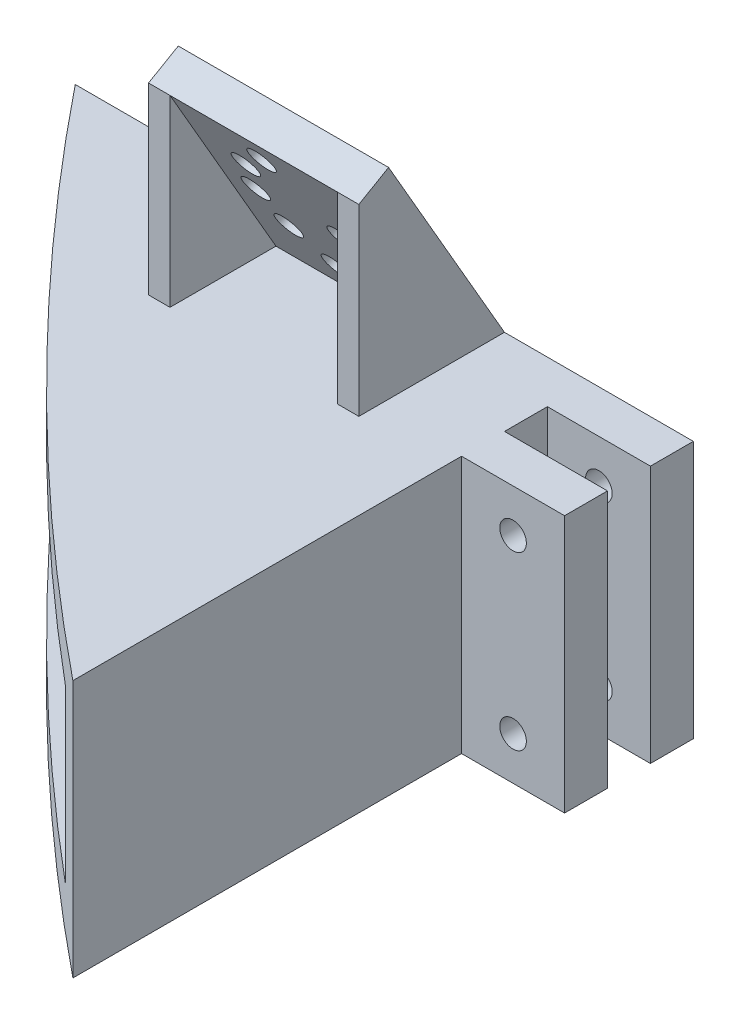
from build123d import *

# Parameters (mm, degrees)
EXTRUDE_1_DEPTH          = 30
CUT_EXTRUDE_1_DEPTH      = 98.124713642
CUT_EXTRUDE_1_DEPTH_BACK = 98.124713642
SKETCH_2_R               = 1.55
CUT_EXTRUDE_6_DEPTH      = 10
EXTRUDE_3_DEPTH          = 12.5
SKETCH_12_W              = 5
SKETCH_12_H              = 30
EXTRUDE_4_DEPTH          = 2
SKETCH_14_W              = 22
SKETCH_14_H              = 27
SKETCH_14_R              = 1.55
EXTRUDE_5_DEPTH          = 4
EXTRUDE_8_DEPTH          = 2.5
EXTRUDE_9_DEPTH          = 2.5


with BuildPart() as part:
    # 草图1 → 凸台-拉伸1 (new body)
    with BuildSketch(Plane(origin=(0, 0, 0), x_dir=(1, 0, 0), z_dir=(0, 1, 0))):
        with BuildLine():
            Line((0, 0), (-70, 0))
            ThreePointArc((-70, 0), (-41.606545869, -31.737243891), (-10, -60.276114672))
            Line((-10, -60.276114672), (-10, -15))
            Line((-10, -15), (0, -15))
            Line((0, -15), (0, -10))
            Line((0, -10), (-10, -10))
            Line((-10, -10), (-10, -5))
            Line((-10, -5), (0, -5))
            Line((0, -5), (0, 0))
        make_face()
    extrude(amount=EXTRUDE_1_DEPTH)

    # 草图2 → 切除-拉伸1 (cut, two sides: drawn at the far end of the back side and taken through both)
    with BuildSketch(Plane(origin=(0, 0, 0), x_dir=(-1, 0, 0), z_dir=(0, 0, -1)).offset(-CUT_EXTRUDE_1_DEPTH_BACK)):
        with Locations((4, 25)):
            Circle(SKETCH_2_R)
        with Locations((4, 5)):
            Circle(SKETCH_2_R)
    extrude(amount=CUT_EXTRUDE_1_DEPTH + CUT_EXTRUDE_1_DEPTH_BACK, mode=Mode.SUBTRACT)

    # 草图9 → 切除-拉伸6 (cut, symmetric)
    with BuildSketch(Plane(origin=(0, 15, 0), x_dir=(1, 0, 0), z_dir=(0, 1, 0))):
        with BuildLine():
            Line((-65.918016471, -5), (-59.391772218, -5))
            Line((-59.391772218, -5), (-15, -5))
            Line((-15, -5), (-15, -15))
            Line((-15, -15), (-15, -49.60330608))
            Line((-15, -49.60330608), (-15, -56.155472209))
            ThreePointArc((-15, -56.155472209), (-41.615194331, -31.728555364), (-65.918016471, -5))
        make_face()
    extrude(amount=CUT_EXTRUDE_6_DEPTH, both=True, mode=Mode.SUBTRACT)

    # 草图11 → 凸台-拉伸3 (add, symmetric)
    with BuildSketch(Plane(origin=(0, 15, 0), x_dir=(1, 0, 0), z_dir=(0, 1, 0))):
        Polygon((-15, -5), (-23, -5), (-15, -10), align=None)
    extrude(amount=EXTRUDE_3_DEPTH, both=True)

    # 草图12 → 凸台-拉伸4 (add)
    with BuildSketch(Plane(origin=(0, 0, 0), x_dir=(0, 0, -1), z_dir=(1, 0, 0))):
        with Locations((-12.5, 15)):
            Rectangle(SKETCH_12_W, SKETCH_12_H)
        with Locations((-2.5, 15)):
            Rectangle(SKETCH_12_W, SKETCH_12_H)
    extrude(amount=EXTRUDE_4_DEPTH)

    # 草图14 → 凸台-拉伸5 (add)
    with BuildSketch(Plane(origin=(0, 7.5, -12.990381057), x_dir=(-1, 0, 0), z_dir=(0, 0.499999999999998, -0.8660254037844398))):
        with Locations((31, 39.480762114)):
            Rectangle(SKETCH_14_W, SKETCH_14_H)
        with Locations((28, 40.980762114)):
            Circle(SKETCH_14_R, mode=Mode.SUBTRACT)
        with Locations((33, 49.641016151)):
            Circle(SKETCH_14_R, mode=Mode.SUBTRACT)
        with Locations((36.660254038, 45.980762114)):
            Circle(SKETCH_14_R, mode=Mode.SUBTRACT)
        with Locations((38, 40.980762114)):
            Circle(SKETCH_14_R, mode=Mode.SUBTRACT)
        with Locations((36.660254038, 35.980762114)):
            Circle(SKETCH_14_R, mode=Mode.SUBTRACT)
        with Locations((33, 32.320508076)):
            Circle(SKETCH_14_R, mode=Mode.SUBTRACT)
    extrude(amount=-EXTRUDE_5_DEPTH)

    # 草图18 → 凸台-拉伸8 (add)
    with BuildSketch(Plane(origin=(-20, 0, 0), x_dir=(0, 0, -1), z_dir=(1, 0, 0))):
        Polygon((-16.964101615, 51.382685902), (-4.618802154, 30), (-16.964101615, 30), align=None)
    extrude(amount=-EXTRUDE_8_DEPTH)

    # 草图19 → 凸台-拉伸9 (add)
    with BuildSketch(Plane.ZY.offset(42)):
        Polygon((0, 30), (13.5, 53.382685902), (16.964101615, 51.382685902), (16.964101615, 30), align=None)
    extrude(amount=EXTRUDE_9_DEPTH)


solid = part.part
